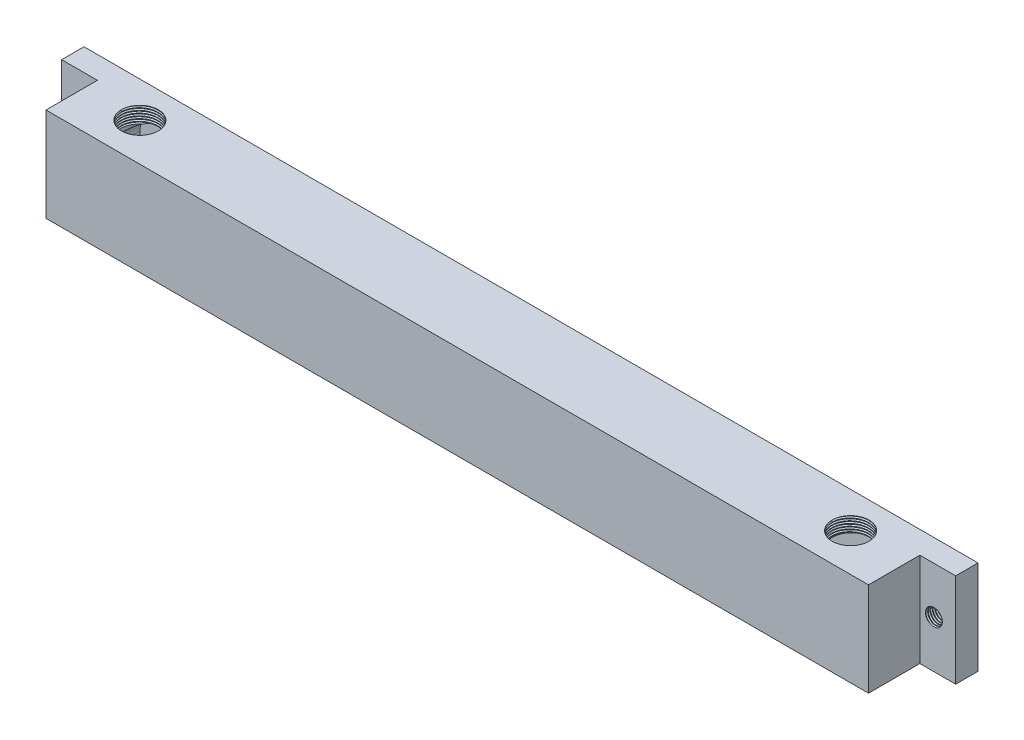
from build123d import *
from build123d.topology import SkipClean

# Parameters (mm, degrees)
SKETCH_2_W          = 368
SKETCH_2_H          = 42
EXTRUDE_1_DEPTH     = 33
SKETCH_2_3_W        = 16
SKETCH_2_3_H        = 42
SKETCH_2_3_R        = 3.5
EXTRUDE_2_DEPTH     = 10
CUT_EXTRUDE_START   = -4
SKETCH_3_W          = 340
SKETCH_3_H          = 28
CUT_EXTRUDE_1_DEPTH = 24
FILLET_1_R          = 8
THREAD_1_PITCH      = 1.058333333
THREAD_2_PITCH      = 1.058333333
CUT_EXTRUDE_2_REACH = 228.86
SKETCH_8_R          = 8.25
THREAD_3_PITCH      = 1.058333333
THREAD_4_PITCH      = 1.058333333


with BuildPart() as part:
    # Sketch 2 → 凸台-拉伸1 (new body)
    with BuildSketch(Plane.XY):
        with Locations((20.481927711, 1.321285141)):
            Rectangle(SKETCH_2_W, SKETCH_2_H)
    extrude(amount=EXTRUDE_1_DEPTH)

    # 草图2<3> → 凸台-拉伸2 (add)
    # profile 1 of 2: a face of its own
    with BuildSketch(Plane.XY):
        with Locations((-171.518072289, 1.321285141)):
            Rectangle(SKETCH_2_3_W, SKETCH_2_3_H)
        with Locations((-169.518072289, 1.321285141)):
            Circle(SKETCH_2_3_R, mode=Mode.SUBTRACT)
    # profile 2 of 2: a face of its own
    with BuildSketch(Plane.XY):
        with Locations((212.481927711, 1.321285141)):
            Rectangle(SKETCH_2_3_W, SKETCH_2_3_H)
        with Locations((210.481927711, 1.321285141)):
            Circle(SKETCH_2_3_R, mode=Mode.SUBTRACT)
    extrude(amount=EXTRUDE_2_DEPTH)

    # Sketch 3 → 切除-拉伸1 (cut)
    with BuildSketch(Plane.XY.offset(33).offset(CUT_EXTRUDE_START)):
        with Locations((20.481927711, 1.321285141)):
            Rectangle(SKETCH_3_W, SKETCH_3_H)
    extrude(amount=-CUT_EXTRUDE_1_DEPTH, mode=Mode.SUBTRACT)

    # 圆角1
    fillet_1_edges = [part.edges().sort_by_distance(p)[0] for p in [
        (-149.518072289, 15.321285141, 17),
        (190.481927711, 15.321285141, 17),
        (190.481927711, -12.678714859, 17),
        (-149.518072289, -12.678714859, 17),
    ]]
    fillet(fillet_1_edges, radius=FILLET_1_R)

    # 螺纹线1: arcs per turn and ends read off the stored shape
    # 螺纹线1: the profile of 螺纹线轮廓1 profile screwed along a right-hand helix through 9.448819 turns, 8 arcs to a turn; built about Z, then put on its axis
    thread_1_z = Axis((0, 0, 0), (0, 0, 1))
    thread_1_corners = [(3.4997, 0, -0.000173205), (4.072839718, 0, 0.330729165), (4.072839718, 0, 0.463020832), (3.4997, 0, 0.793923202)]
    with BuildLine(mode=Mode.PRIVATE) as thread_1_profile:
        Line(thread_1_corners[0], thread_1_corners[1])
        Line(thread_1_corners[1], thread_1_corners[2])
        Line(thread_1_corners[2], thread_1_corners[3])
        Line(thread_1_corners[3], thread_1_corners[0])
    thread_1_cap = Face(thread_1_profile.wire())
    thread_1_turn_angles = [0, 22.5, 45, 67.5, 90, 112.5, 135, 157.5, 180, 202.5, 225, 247.5, 270, 292.5, 315, 337.5, 360]
    thread_1_turn_weights = [1, 0.9238795325112867, 1, 0.9238795325112867, 1, 0.9238795325112867, 1, 0.9238795325112867, 1, 0.9238795325112867, 1, 0.9238795325112867, 1, 0.9238795325112867, 1, 0.9238795325112867, 1]
    thread_1_turn_rails = [Edge.make_bspline([Vector(p[0], p[1], 0).rotate(thread_1_z, thread_1_turn_angles[k]) / thread_1_turn_weights[k] + Vector(0, 0, p[2] + THREAD_1_PITCH * thread_1_turn_angles[k] / 360) for k in range(17)], [0, 0, 0, 1, 1, 2, 2, 3, 3, 4, 4, 5, 5, 6, 6, 7, 7, 8, 8, 8], 2, thread_1_turn_weights) for p in thread_1_corners]
    thread_1_turn_sides = [Face.make_surface_from_curves(thread_1_turn_rails[p[0]], thread_1_turn_rails[p[1]]) for p in [(0, 1), (1, 2), (2, 3), (3, 0)]]
    thread_1_last_angles = [3240, 3262.5, 3285, 3307.5, 3330, 3352.5, 3375, 3388.287401575, 3401.57480315]
    thread_1_last_weights = [1, 0.9238795325112867, 1, 0.9238795325112867, 1, 0.9238795325112867, 1, 0.9732294335070495, 1]
    thread_1_last_rails = [Edge.make_bspline([Vector(p[0], p[1], 0).rotate(thread_1_z, thread_1_last_angles[k]) / thread_1_last_weights[k] + Vector(0, 0, p[2] + THREAD_1_PITCH * thread_1_last_angles[k] / 360) for k in range(9)], [0, 0, 0, 1, 1, 2, 2, 3, 3, 4, 4, 4], 2, thread_1_last_weights) for p in thread_1_corners]
    thread_1_last_sides = [Face.make_surface_from_curves(thread_1_last_rails[p[0]], thread_1_last_rails[p[1]]) for p in [(0, 1), (1, 2), (2, 3), (3, 0)]]
    thread_1 = Plane(origin=(210.481927711, 1.321285141, 0), x_dir=(1, 0, 0), z_dir=(0, 0, 1)) * Solid(Shell([*[p.moved(Location((0, 0, THREAD_1_PITCH * i))) for i in range(9) for p in thread_1_turn_sides], *thread_1_last_sides, thread_1_cap, thread_1_cap.rotate(thread_1_z, 3401.57480315).moved(Location((0, 0, THREAD_1_PITCH * 3401.57480315 / 360)))]))
    add(thread_1, mode=Mode.SUBTRACT)

    # 螺纹线2: arcs per turn and ends read off the stored shape
    # 螺纹线2: the profile of Sketch 2 2 profile screwed along a right-hand helix through 9.448819 turns, 8 arcs to a turn; built about Z, then put on its axis
    thread_2_z = Axis((0, 0, 0), (0, 0, 1))
    thread_2_corners = [(3.4997, 0, -0.000173205), (4.072839718, 0, 0.330729165), (4.072839718, 0, 0.463020832), (3.4997, 0, 0.793923202)]
    with BuildLine(mode=Mode.PRIVATE) as thread_2_profile:
        Line(thread_2_corners[0], thread_2_corners[1])
        Line(thread_2_corners[1], thread_2_corners[2])
        Line(thread_2_corners[2], thread_2_corners[3])
        Line(thread_2_corners[3], thread_2_corners[0])
    thread_2_cap = Face(thread_2_profile.wire())
    thread_2_turn_angles = [0, 22.5, 45, 67.5, 90, 112.5, 135, 157.5, 180, 202.5, 225, 247.5, 270, 292.5, 315, 337.5, 360]
    thread_2_turn_weights = [1, 0.9238795325112867, 1, 0.9238795325112867, 1, 0.9238795325112867, 1, 0.9238795325112867, 1, 0.9238795325112867, 1, 0.9238795325112867, 1, 0.9238795325112867, 1, 0.9238795325112867, 1]
    thread_2_turn_rails = [Edge.make_bspline([Vector(p[0], p[1], 0).rotate(thread_2_z, thread_2_turn_angles[k]) / thread_2_turn_weights[k] + Vector(0, 0, p[2] + THREAD_2_PITCH * thread_2_turn_angles[k] / 360) for k in range(17)], [0, 0, 0, 1, 1, 2, 2, 3, 3, 4, 4, 5, 5, 6, 6, 7, 7, 8, 8, 8], 2, thread_2_turn_weights) for p in thread_2_corners]
    thread_2_turn_sides = [Face.make_surface_from_curves(thread_2_turn_rails[p[0]], thread_2_turn_rails[p[1]]) for p in [(0, 1), (1, 2), (2, 3), (3, 0)]]
    thread_2_last_angles = [3240, 3262.5, 3285, 3307.5, 3330, 3352.5, 3375, 3388.287401575, 3401.57480315]
    thread_2_last_weights = [1, 0.9238795325112867, 1, 0.9238795325112867, 1, 0.9238795325112867, 1, 0.9732294335070495, 1]
    thread_2_last_rails = [Edge.make_bspline([Vector(p[0], p[1], 0).rotate(thread_2_z, thread_2_last_angles[k]) / thread_2_last_weights[k] + Vector(0, 0, p[2] + THREAD_2_PITCH * thread_2_last_angles[k] / 360) for k in range(9)], [0, 0, 0, 1, 1, 2, 2, 3, 3, 4, 4, 4], 2, thread_2_last_weights) for p in thread_2_corners]
    thread_2_last_sides = [Face.make_surface_from_curves(thread_2_last_rails[p[0]], thread_2_last_rails[p[1]]) for p in [(0, 1), (1, 2), (2, 3), (3, 0)]]
    thread_2 = Plane(origin=(-169.518072289, 1.321285141, 0), x_dir=(1, 0, 0), z_dir=(0, 0, 1)) * Solid(Shell([*[p.moved(Location((0, 0, THREAD_2_PITCH * i))) for i in range(9) for p in thread_2_turn_sides], *thread_2_last_sides, thread_2_cap, thread_2_cap.rotate(thread_2_z, 3401.57480315).moved(Location((0, 0, THREAD_2_PITCH * 3401.57480315 / 360)))]))
    add(thread_2, mode=Mode.SUBTRACT)

    # 草图8 → 切除-拉伸2 (cut, up to next)
    with BuildSketch(Plane(origin=(0, 22.321285141, 0), x_dir=(1, 0, 0), z_dir=(0, 1, 0)), mode=Mode.PRIVATE) as cut_extrude_2_sk1:
        with Locations(Location((179.481927711, -16, 0), (0, 0, 270))):
            Circle(SKETCH_8_R)
    cut_extrude_2_tool1 = extrude(cut_extrude_2_sk1.sketch, amount=-CUT_EXTRUDE_2_REACH, mode=Mode.PRIVATE) & part.part
    # 草图8 → 切除-拉伸2 (cut, up to next)
    with BuildSketch(Plane(origin=(0, 22.321285141, 0), x_dir=(1, 0, 0), z_dir=(0, 1, 0)), mode=Mode.PRIVATE) as cut_extrude_2_sk2:
        with Locations(Location((-138.518072289, -16, 0), (0, 0, 270))):
            Circle(SKETCH_8_R)
    cut_extrude_2_tool2 = extrude(cut_extrude_2_sk2.sketch, amount=-CUT_EXTRUDE_2_REACH, mode=Mode.PRIVATE) & part.part
    add(cut_extrude_2_tool1.solids().sort_by_distance((179.481928, 22.321285, 16))[0], mode=Mode.SUBTRACT)
    add(cut_extrude_2_tool2.solids().sort_by_distance((-138.518072, 22.321285, 16))[0], mode=Mode.SUBTRACT)

    # 螺纹线3: arcs per turn and ends read off the stored shape
    # 螺纹线3: the profile of Sketch 3 2 profile screwed along a right-hand helix through 6.614173 turns, 8 arcs to a turn; built about Z, then put on its axis
    with SkipClean():  # the faces are left unmerged after this step: merging them gives an invalid solid
        thread_3_z = Axis((0, 0, 0), (0, 0, 1))
        thread_3_corners = [(8.2497, 0, -0.000173205), (8.822839718, 0, 0.330729166), (8.822839718, 0, 0.463020832), (8.2497, 0, 0.793923203)]
        with BuildLine(mode=Mode.PRIVATE) as thread_3_profile:
            Line(thread_3_corners[0], thread_3_corners[1])
            Line(thread_3_corners[1], thread_3_corners[2])
            Line(thread_3_corners[2], thread_3_corners[3])
            Line(thread_3_corners[3], thread_3_corners[0])
        thread_3_cap = Face(thread_3_profile.wire())
        thread_3_turn_angles = [0, 22.5, 45, 67.5, 90, 112.5, 135, 157.5, 180, 202.5, 225, 247.5, 270, 292.5, 315, 337.5, 360]
        thread_3_turn_weights = [1, 0.9238795325112867, 1, 0.9238795325112867, 1, 0.9238795325112867, 1, 0.9238795325112867, 1, 0.9238795325112867, 1, 0.9238795325112867, 1, 0.9238795325112867, 1, 0.9238795325112867, 1]
        thread_3_turn_rails = [Edge.make_bspline([Vector(p[0], p[1], 0).rotate(thread_3_z, thread_3_turn_angles[k]) / thread_3_turn_weights[k] + Vector(0, 0, p[2] + THREAD_3_PITCH * thread_3_turn_angles[k] / 360) for k in range(17)], [0, 0, 0, 1, 1, 2, 2, 3, 3, 4, 4, 5, 5, 6, 6, 7, 7, 8, 8, 8], 2, thread_3_turn_weights) for p in thread_3_corners]
        thread_3_turn_sides = [Face.make_surface_from_curves(thread_3_turn_rails[p[0]], thread_3_turn_rails[p[1]]) for p in [(0, 1), (1, 2), (2, 3), (3, 0)]]
        thread_3_last_angles = [2160, 2182.5, 2205, 2227.5, 2250, 2272.5, 2295, 2317.5, 2340, 2360.551181102, 2381.102362205]
        thread_3_last_weights = [1, 0.9238795325112867, 1, 0.9238795325112867, 1, 0.9238795325112867, 1, 0.9238795325112867, 1, 0.9363589827705695, 1]
        thread_3_last_rails = [Edge.make_bspline([Vector(p[0], p[1], 0).rotate(thread_3_z, thread_3_last_angles[k]) / thread_3_last_weights[k] + Vector(0, 0, p[2] + THREAD_3_PITCH * thread_3_last_angles[k] / 360) for k in range(11)], [0, 0, 0, 1, 1, 2, 2, 3, 3, 4, 4, 5, 5, 5], 2, thread_3_last_weights) for p in thread_3_corners]
        thread_3_last_sides = [Face.make_surface_from_curves(thread_3_last_rails[p[0]], thread_3_last_rails[p[1]]) for p in [(0, 1), (1, 2), (2, 3), (3, 0)]]
        thread_3 = Plane(origin=(179.481927711, 22.321285141, 16), x_dir=(-1, 0, 0), z_dir=(0, -1, 0)) * Solid(Shell([*[p.moved(Location((0, 0, THREAD_3_PITCH * i))) for i in range(6) for p in thread_3_turn_sides], *thread_3_last_sides, thread_3_cap, thread_3_cap.rotate(thread_3_z, 2381.102362205).moved(Location((0, 0, THREAD_3_PITCH * 2381.102362205 / 360)))]))
        add(thread_3, mode=Mode.SUBTRACT)

    # 螺纹线4: arcs per turn and ends read off the stored shape
    # 螺纹线4: the profile of 螺纹线轮廓4 profile screwed along a right-hand helix through 6.614173 turns, 8 arcs to a turn; built about Z, then put on its axis
    with SkipClean():  # the faces are left unmerged after this step: merging them gives an invalid solid
        thread_4_z = Axis((0, 0, 0), (0, 0, 1))
        thread_4_corners = [(8.2497, 0, -0.000173205), (8.822839718, 0, 0.330729166), (8.822839718, 0, 0.463020832), (8.2497, 0, 0.793923203)]
        with BuildLine(mode=Mode.PRIVATE) as thread_4_profile:
            Line(thread_4_corners[0], thread_4_corners[1])
            Line(thread_4_corners[1], thread_4_corners[2])
            Line(thread_4_corners[2], thread_4_corners[3])
            Line(thread_4_corners[3], thread_4_corners[0])
        thread_4_cap = Face(thread_4_profile.wire())
        thread_4_turn_angles = [0, 22.5, 45, 67.5, 90, 112.5, 135, 157.5, 180, 202.5, 225, 247.5, 270, 292.5, 315, 337.5, 360]
        thread_4_turn_weights = [1, 0.9238795325112867, 1, 0.9238795325112867, 1, 0.9238795325112867, 1, 0.9238795325112867, 1, 0.9238795325112867, 1, 0.9238795325112867, 1, 0.9238795325112867, 1, 0.9238795325112867, 1]
        thread_4_turn_rails = [Edge.make_bspline([Vector(p[0], p[1], 0).rotate(thread_4_z, thread_4_turn_angles[k]) / thread_4_turn_weights[k] + Vector(0, 0, p[2] + THREAD_4_PITCH * thread_4_turn_angles[k] / 360) for k in range(17)], [0, 0, 0, 1, 1, 2, 2, 3, 3, 4, 4, 5, 5, 6, 6, 7, 7, 8, 8, 8], 2, thread_4_turn_weights) for p in thread_4_corners]
        thread_4_turn_sides = [Face.make_surface_from_curves(thread_4_turn_rails[p[0]], thread_4_turn_rails[p[1]]) for p in [(0, 1), (1, 2), (2, 3), (3, 0)]]
        thread_4_last_angles = [2160, 2182.5, 2205, 2227.5, 2250, 2272.5, 2295, 2317.5, 2340, 2360.551181102, 2381.102362205]
        thread_4_last_weights = [1, 0.9238795325112867, 1, 0.9238795325112867, 1, 0.9238795325112867, 1, 0.9238795325112867, 1, 0.9363589827705263, 1]
        thread_4_last_rails = [Edge.make_bspline([Vector(p[0], p[1], 0).rotate(thread_4_z, thread_4_last_angles[k]) / thread_4_last_weights[k] + Vector(0, 0, p[2] + THREAD_4_PITCH * thread_4_last_angles[k] / 360) for k in range(11)], [0, 0, 0, 1, 1, 2, 2, 3, 3, 4, 4, 5, 5, 5], 2, thread_4_last_weights) for p in thread_4_corners]
        thread_4_last_sides = [Face.make_surface_from_curves(thread_4_last_rails[p[0]], thread_4_last_rails[p[1]]) for p in [(0, 1), (1, 2), (2, 3), (3, 0)]]
        thread_4 = Plane(origin=(-138.518072289, 22.321285141, 16), x_dir=(-1, 0, 0), z_dir=(0, -1, 0)) * Solid(Shell([*[p.moved(Location((0, 0, THREAD_4_PITCH * i))) for i in range(6) for p in thread_4_turn_sides], *thread_4_last_sides, thread_4_cap, thread_4_cap.rotate(thread_4_z, 2381.102362205).moved(Location((0, 0, THREAD_4_PITCH * 2381.102362205 / 360)))]))
        add(thread_4, mode=Mode.SUBTRACT)


solid = part.part
